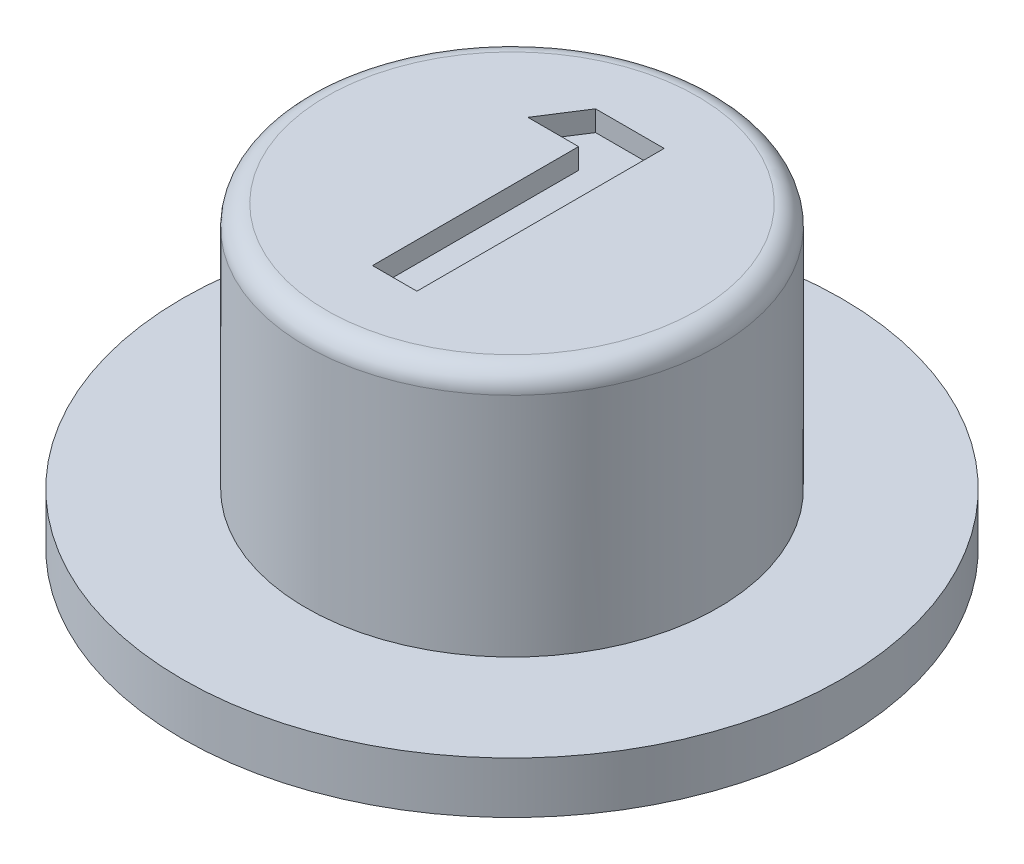
from build123d import *

# Parameters (mm, degrees)
SKETCH2_W          = 3.5
SKETCH2_H          = 2.5
CUT_EXTRUDE1_DEPTH = 3.5
FILLET1_R          = 0.5
CUT_EXTRUDE2_DEPTH = 0.5


with BuildPart() as part:
    # Sketch1 → Revolve1 (revolve)
    with BuildSketch(Plane.XY):
        Polygon((0, 7.25), (5, 7.25), (5, 1.25), (8, 1.25), (8, 0), (0, 0), align=None)
    revolve(axis=Axis((0, 7.25, 0), (0, -1, 0)))

    # Sketch2 → Cut-Extrude1 (cut)
    with BuildSketch(Plane.XZ):
        Rectangle(SKETCH2_W, SKETCH2_H)
    extrude(amount=-CUT_EXTRUDE1_DEPTH, mode=Mode.SUBTRACT)

    # Fillet1
    fillet1_edges = [part.edges().sort_by_distance(p)[0] for p in [
        (-5, 7.25, 0),
    ]]
    fillet(fillet1_edges, radius=FILLET1_R)

    # Sketch3 → Cut-Extrude2 (cut)
    with BuildSketch(Plane(origin=(0, 7.25, 0), x_dir=(1, 0, 0), z_dir=(0, 1, 0))):
        Polygon((-0.972355769, 3), (0.692307692, 3), (0.692307692, -3), (-0.384615385, -3), (-0.384615385, 2), (-1.615384615, 2), align=None)
    extrude(amount=-CUT_EXTRUDE2_DEPTH, mode=Mode.SUBTRACT)


solid = part.part
